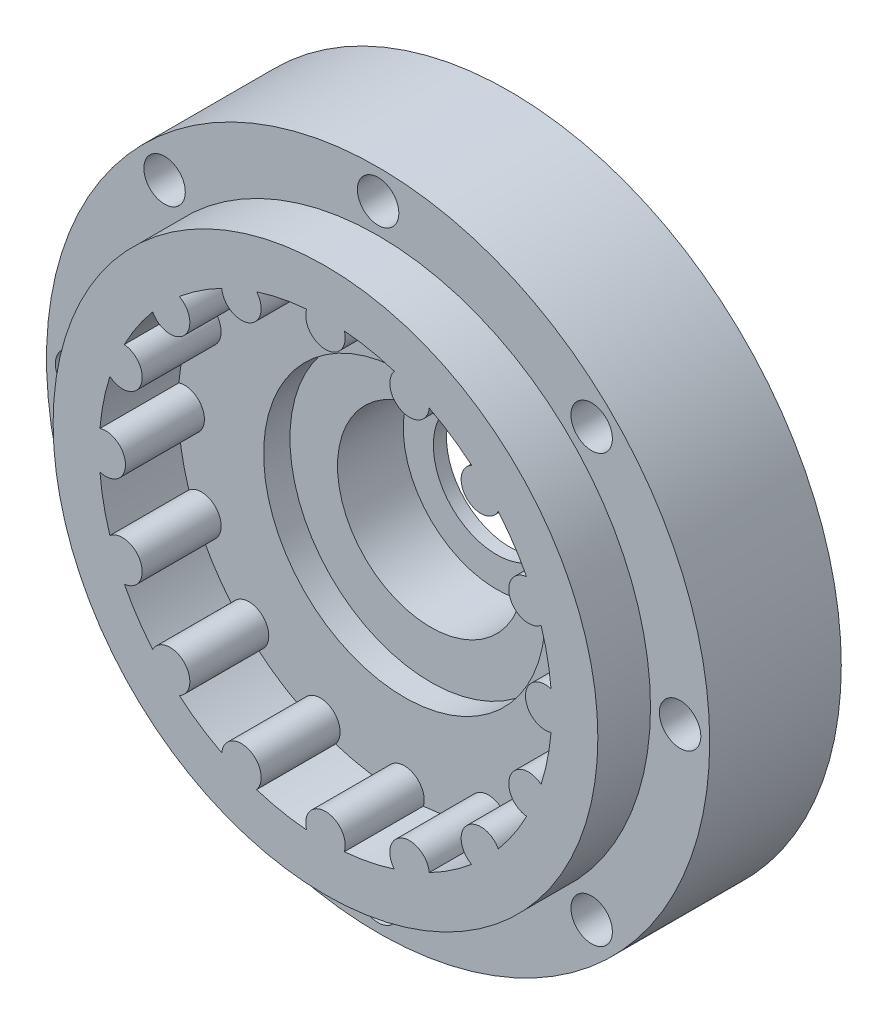
from build123d import *

# Parameters (mm, degrees)
SKETCH1_R           = 32.004
BOSS_EXTRUDE1_DEPTH = 12.7
SKETCH2_OUTSIDE_W   = 84.29
SKETCH2_OUTSIDE_H   = 84.29
SKETCH2_OUTSIDE_R   = 32.004
SKETCH2_OUTSIDE_R_2 = 26.289
CUT_EXTRUDE1_DEPTH  = 2.54
SKETCH4_R           = 13.589
CUT_EXTRUDE3_DEPTH  = 2.54
SKETCH5_R           = 6.1
CUT_EXTRUDE4_DEPTH  = 46.897455616
SKETCH5_3_R         = 9
SKETCH5_3_R_2       = 6.1
CUT_EXTRUDE5_DEPTH  = 6.35
BOSS_EXTRUDE2_START = 7.62
SKETCH8_R           = 26.289
SKETCH8_R_2         = 21.844
BOSS_EXTRUDE2_DEPTH = 7.62
SKETCH3_R           = 1.905
BOSS_EXTRUDE3_DEPTH = 7.62
SKETCH6_R           = 2
CUT_EXTRUDE6_DEPTH  = 48.008531481


with BuildPart() as part:
    # Sketch1 → Boss-Extrude1 (new body)
    with BuildSketch(Plane.XY):
        Circle(SKETCH1_R)
    extrude(amount=BOSS_EXTRUDE1_DEPTH)

    # Sketch2 outside → Cut-Extrude1 (cut)
    # profile 1 of 2: a face of its own
    with BuildSketch(Plane.XY.offset(12.7)):
        Rectangle(SKETCH2_OUTSIDE_W, SKETCH2_OUTSIDE_H)
        Circle(SKETCH2_OUTSIDE_R, mode=Mode.SUBTRACT)
    # profile 2 of 2: a face of its own
    with BuildSketch(Plane.XY.offset(12.7)):
        Circle(SKETCH2_OUTSIDE_R_2)
    extrude(amount=-CUT_EXTRUDE1_DEPTH, mode=Mode.SUBTRACT)

    # Sketch4 → Cut-Extrude3 (cut)
    with BuildSketch(Plane.XY.offset(10.16)):
        Circle(SKETCH4_R)
    extrude(amount=-CUT_EXTRUDE3_DEPTH, mode=Mode.SUBTRACT)

    # Sketch5 → Cut-Extrude4 (cut, through all)
    with BuildSketch(Plane.XY.offset(7.62)):
        Circle(SKETCH5_R)
    extrude(amount=-CUT_EXTRUDE4_DEPTH, mode=Mode.SUBTRACT)

    # Sketch5<3> → Cut-Extrude5 (cut)
    with BuildSketch(Plane.XY.offset(7.62)):
        Circle(SKETCH5_3_R)
        Circle(SKETCH5_3_R_2, mode=Mode.SUBTRACT)
    extrude(amount=-CUT_EXTRUDE5_DEPTH, mode=Mode.SUBTRACT)

    # Sketch8 → Boss-Extrude2 (add)
    with BuildSketch(Plane.XY.offset(10.16).offset(BOSS_EXTRUDE2_START)):
        Circle(SKETCH8_R)
        Circle(SKETCH8_R_2, mode=Mode.SUBTRACT)
    extrude(amount=-BOSS_EXTRUDE2_DEPTH)

    # Sketch3 → Boss-Extrude3 (add)
    with BuildSketch(Plane.XY.offset(10.16)):
        with Locations((0, 21.209)):
            Circle(SKETCH3_R)
        with Locations((8.116332917, 19.594561005)):
            Circle(SKETCH3_R)
        with Locations((14.997027722, 14.997027722)):
            Circle(SKETCH3_R)
        with Locations((19.594561005, 8.116332917)):
            Circle(SKETCH3_R)
        with Locations((21.209, 0)):
            Circle(SKETCH3_R)
        with Locations((19.594561005, -8.116332917)):
            Circle(SKETCH3_R)
        with Locations((14.997027722, -14.997027722)):
            Circle(SKETCH3_R)
        with Locations((8.116332917, -19.594561005)):
            Circle(SKETCH3_R)
        with Locations((0, -21.209)):
            Circle(SKETCH3_R)
        with Locations((-8.116332917, -19.594561005)):
            Circle(SKETCH3_R)
        with Locations((-14.997027722, -14.997027722)):
            Circle(SKETCH3_R)
        with Locations((-19.594561005, -8.116332917)):
            Circle(SKETCH3_R)
        with Locations((-21.209, 0)):
            Circle(SKETCH3_R)
        with Locations((-19.594561005, 8.116332917)):
            Circle(SKETCH3_R)
        with Locations((-14.997027722, 14.997027722)):
            Circle(SKETCH3_R)
        with Locations((-8.116332917, 19.594561005)):
            Circle(SKETCH3_R)
    extrude(amount=BOSS_EXTRUDE3_DEPTH)

    # Sketch6 → Cut-Extrude6 (cut, through all)
    with BuildSketch(Plane.XY.offset(12.7)):
        with Locations((0, 29.1465)):
            Circle(SKETCH6_R)
        with Locations((20.609687798, 20.609687798)):
            Circle(SKETCH6_R)
        with Locations((29.1465, 0)):
            Circle(SKETCH6_R)
        with Locations((20.609687798, -20.609687798)):
            Circle(SKETCH6_R)
        with Locations((0, -29.1465)):
            Circle(SKETCH6_R)
        with Locations((-20.609687798, -20.609687798)):
            Circle(SKETCH6_R)
        with Locations((-29.1465, 0)):
            Circle(SKETCH6_R)
        with Locations((-20.609687798, 20.609687798)):
            Circle(SKETCH6_R)
    extrude(amount=-CUT_EXTRUDE6_DEPTH, mode=Mode.SUBTRACT)


solid = part.part
